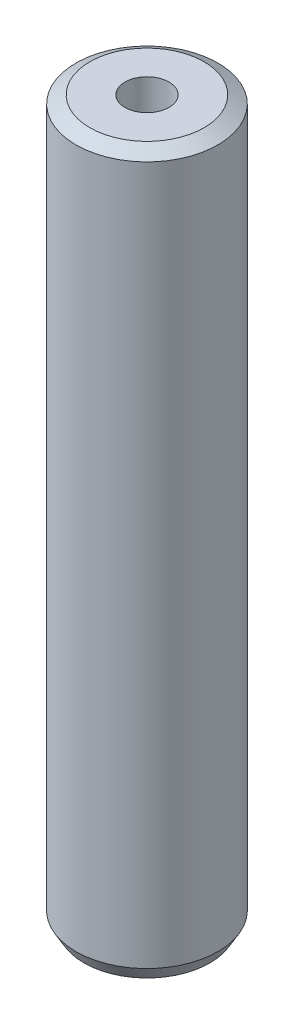
from build123d import *
from OCP.BRepFilletAPI import BRepFilletAPI_MakeChamfer

# Parameters (mm, degrees)
SKETCH1_R           = 52.5
BOSS_EXTRUDE1_DEPTH = 532.833848758
SKETCH2_R           = 16.29398675
CUT_EXTRUDE1_DEPTH  = 538.981793727
CHAMFER1_SIZE       = 5.909798984
CHAMFER1_SIZE2      = 10.236072102


with BuildPart() as part:
    # Sketch1 → Boss-Extrude1 (new body)
    with BuildSketch(Plane(origin=(0, 0, 0), x_dir=(1, 0, 0), z_dir=(0, 1, 0))):
        Circle(SKETCH1_R)
    extrude(amount=BOSS_EXTRUDE1_DEPTH)

    # Sketch2 → Cut-Extrude1 (cut, through all)
    with BuildSketch(Plane(origin=(0, 0, 0), x_dir=(1, 0, 0), z_dir=(0, 1, 0))):
        Circle(SKETCH2_R)
    extrude(amount=CUT_EXTRUDE1_DEPTH, mode=Mode.SUBTRACT)

    # Chamfer1: one chamfer whose edges measure the first distance from different faces: ONE call of the kernel's chamfer builder (chamfer() names one face for all edges)
    chamfer1_edges_1 = [part.edges().sort_by_distance(p)[0] for p in [
        (-52.5, 532.833848758, 0),
    ]]
    chamfer1_side_1 = [part.faces().sort_by_distance(p)[0] for p in [
        (-52.5, 266.416924379, 0),
    ]]
    chamfer1_edges_2 = [part.edges().sort_by_distance(p)[0] for p in [
        (-52.5, 0, 0),
    ]]
    chamfer1_side_2 = [part.faces().sort_by_distance(p)[0] for p in [
        (-51.01507576, 0, 0),
    ]]
    chamfer1 = BRepFilletAPI_MakeChamfer(part.part.solid().wrapped)
    for e in chamfer1_edges_1:
        chamfer1.Add(CHAMFER1_SIZE, CHAMFER1_SIZE2, e.wrapped, chamfer1_side_1[0].wrapped)  # the first distance lies on this face
    for e in chamfer1_edges_2:
        chamfer1.Add(CHAMFER1_SIZE, CHAMFER1_SIZE2, e.wrapped, chamfer1_side_2[0].wrapped)  # the first distance lies on this face
    add(Compound.cast(chamfer1.Shape()), mode=Mode.REPLACE)


solid = part.part
